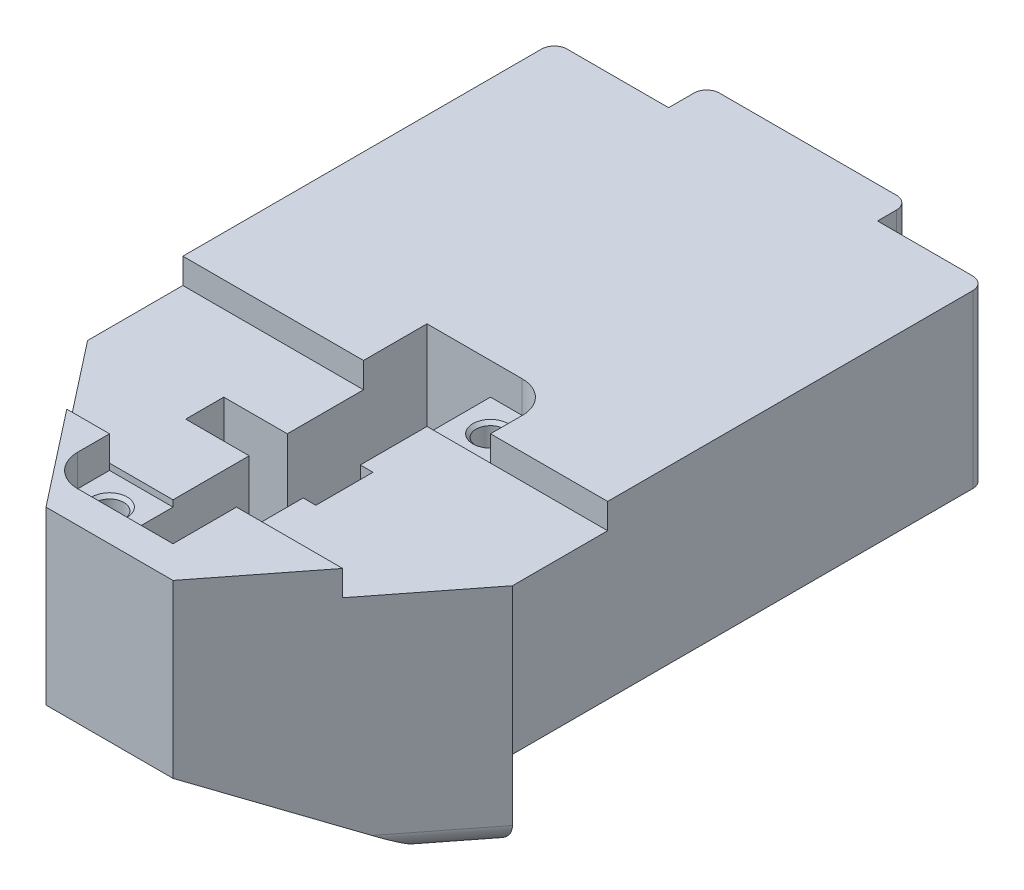
from build123d import *

# Parameters (mm, degrees)
BOSS_EXTRUDE1_DEPTH     = 7.7
SKETCH2_W               = 7
SKETCH2_H               = 3.1
CUT_EXTRUDE1_DEPTH      = 79.027559234
FILLET1_R               = 10
BOSS_EXTRUDE2_DEPTH     = 2
SKETCH4_W               = 109.5
SKETCH4_H               = 25
BOSS_EXTRUDE3_DEPTH     = 33.45
BOSS_EXTRUDE4_REACH     = 117.534
CUT_EXTRUDE2_DEPTH      = 114.458814113
CUT_EXTRUDE2_DEPTH_BACK = 114.458814113
CUT_EXTRUDE3_DEPTH      = 10
FILLET3_R               = 1
CUT_EXTRUDE5_REACH      = 117.534
SKETCH9_W               = 30
SKETCH9_H               = 4
FILLET5_R               = 3
CUT_EXTRUDE4_REACH      = 119.132
SKETCH8_W               = 17
SKETCH8_H               = 5
SKETCH8_W_2             = 19
SKETCH8_H_2             = 7
FILLET6_R               = 2
FILLET7_R               = 2
SKETCH11_W              = 10
SKETCH11_H              = 10
CUT_EXTRUDE6_DEPTH      = 22
CUT_EXTRUDE9_DEPTH      = 5
SKETCH12_R              = 2.275
CUT_EXTRUDE7_DEPTH      = 8
CHAMFER1_SIZE           = 0.5
SKETCH13_W              = 2
SKETCH13_H              = 9
SKETCH13_W_2            = 10
SKETCH13_H_2            = 6
CUT_EXTRUDE10_DEPTH     = 18


with BuildPart() as part:
    # Sketch1 → Boss-Extrude1 (new body)
    with BuildSketch(Plane(origin=(0, 0, 0), x_dir=(1, 0, 0), z_dir=(0, 1, 0))):
        Polygon((0, 0), (-16.35, 0), (-16.35, -9.85), (-2.6, -9.85), (-2.6, -33), (-20.1, -33), (-20.1, -75), (0, -75), align=None)
    extrude(amount=BOSS_EXTRUDE1_DEPTH)

    # Sketch2 → Cut-Extrude1 (cut, through all)
    with BuildSketch(Plane.XY.offset(75)):
        with Locations((-16.6, 3.55)):
            Rectangle(SKETCH2_W, SKETCH2_H)
    extrude(amount=-CUT_EXTRUDE1_DEPTH, mode=Mode.SUBTRACT)

    # Fillet1
    fillet1_edges = [part.edges().sort_by_distance(p)[0] for p in [
        (-2.6, 3.85, 33),
    ]]
    fillet(fillet1_edges, radius=FILLET1_R)

    # Sketch3 → Boss-Extrude2 (add)
    with BuildSketch(Plane(origin=(0, 7.7, 0), x_dir=(1, 0, 0), z_dir=(0, 1, 0))):
        Polygon((0, 4.5), (-33.45, 4.5), (-33.45, -75), (-10, -105), (0, -105), align=None)
    extrude(amount=BOSS_EXTRUDE2_DEPTH)

    # Sketch4 → Boss-Extrude3 (add)
    with BuildSketch(Plane(origin=(0, 0, 0), x_dir=(0, 0, -1), z_dir=(1, 0, 0))):
        with Locations((-50.25, 22.2)):
            Rectangle(SKETCH4_W, SKETCH4_H)
    extrude(amount=-BOSS_EXTRUDE3_DEPTH)

    # Boss-Extrude4: up to this face of the body (flat: up to its plane)
    boss_extrude4_end = Plane(part.part.faces().sort_by_distance((0, 18.36479202, 48.166489813))[0])
    # Sketch5 → Boss-Extrude4 (add, up to the picked face)
    with BuildSketch(Plane.ZY.offset(33.45), mode=Mode.PRIVATE) as boss_extrude4_sk1:
        Polygon((75, 7.7), (75, -5), (82, -5), (105, 7.7), align=None)
    boss_extrude4_tool1 = split(extrude(boss_extrude4_sk1.sketch, amount=-BOSS_EXTRUDE4_REACH, mode=Mode.PRIVATE), bisect_by=boss_extrude4_end, keep=Keep.BOTH, mode=Mode.PRIVATE)
    add(boss_extrude4_tool1.solids().sort_by(Axis((-33.45, 2.665766, 85.441441), (1, 0, 0)))[0])

    # Sketch6 → Cut-Extrude2 (cut, two sides: drawn at the far end of the back side and taken through both)
    with BuildSketch(Plane(origin=(0, 7.7, 0), x_dir=(1, 0, 0), z_dir=(0, 1, 0)).offset(-CUT_EXTRUDE2_DEPTH_BACK)):
        Polygon((-33.45, -75), (-10, -105), (-33.45, -105), align=None)
    extrude(amount=CUT_EXTRUDE2_DEPTH + CUT_EXTRUDE2_DEPTH_BACK, mode=Mode.SUBTRACT)

    # Sketch7 → Cut-Extrude3 (cut)
    with BuildSketch(Plane(origin=(0, 0, 0), x_dir=(0, 0, -1), z_dir=(1, 0, 0))):
        Polygon((-75, 0), (-85, 0), (-80, -5), (-75, -5), align=None)
    extrude(amount=-CUT_EXTRUDE3_DEPTH, mode=Mode.SUBTRACT)

    # Fillet3
    # the kernel refuses this fillet: 1 mm, written as the material it takes off along each edge
    with BuildSketch(Plane(origin=(5.810983209, -5, 80), x_dir=(0, 0.707106781186549, 0.7071067811865459), z_dir=(-1, 0, 0))) as fillet3_piece_1:
        with BuildLine():
            CenterArc((2.324393283, -1), FILLET3_R, 90, 114.469800521)
            Line((1.414213562, -1.414213562), (1.396009968, -1.422497834))
            ThreePointArc((1.396009968, -1.422497834), (0.692964646, -0.721248917), (-0.014142136, -0.014142136))
            Line((-0.014142136, -0.014142136), (0, 0.02))
            Line((0, 0.02), (2.324393283, 0.02))
            Line((2.324393283, 0.02), (2.324393283, 0))
        make_face()
    extrude(amount=15.810983209, mode=Mode.SUBTRACT)
    with BuildSketch(Plane(origin=(-10, -5, 82.5), x_dir=(0, 1, 0), z_dir=(0, 0, -1))) as fillet3_piece_2_section:
        with BuildLine():
            CenterArc((FILLET3_R, -FILLET3_R), FILLET3_R, 90, 90)
            Line((0, -FILLET3_R), (-FILLET3_R * 0.02, -FILLET3_R))
            Line((-FILLET3_R * 0.02, -FILLET3_R), (-FILLET3_R * 0.02, FILLET3_R * 0.02))
            Line((-FILLET3_R * 0.02, FILLET3_R * 0.02), (FILLET3_R, FILLET3_R * 0.02))
            Line((FILLET3_R, FILLET3_R * 0.02), (FILLET3_R, 0))
        make_face()
    fillet3_piece_2 = extrude(amount=10, mode=Mode.PRIVATE)
    fillet3_piece_2 = split(fillet3_piece_2, bisect_by=Plane(origin=(-10.222841489, -6.700692184, 78.299307816), z_dir=(0, 0.7071067811865466, -0.7071067811865485)), keep=Keep.TOP, mode=Mode.PRIVATE)
    add(fillet3_piece_2, mode=Mode.SUBTRACT)
    with BuildSketch(Plane(origin=(5.810983209, -5, 80), x_dir=(0, 0.707106781186549, 0.7071067811865459), z_dir=(-1, 0, 0))) as fillet3_piece_3a_section:
        with BuildLine():
            CenterArc((2.324393283, -1), FILLET3_R, 90, 114.469800521)
            Line((1.414213562, -1.414213562), (1.396009968, -1.422497834))
            ThreePointArc((1.396009968, -1.422497834), (0.692964646, -0.721248917), (-0.014142136, -0.014142136))
            Line((-0.014142136, -0.014142136), (0, 0.02))
            Line((0, 0.02), (2.324393283, 0.02))
            Line((2.324393283, 0.02), (2.324393283, 0))
        make_face()
    fillet3_piece_3a = extrude(amount=21.621966417, mode=Mode.PRIVATE)
    fillet3_piece_3a = split(fillet3_piece_3a, bisect_by=Plane(origin=(-10, -4.567151235, 80.996776665), z_dir=(-1, 0, 0)), keep=Keep.TOP, mode=Mode.PRIVATE)
    with BuildSketch(Plane(origin=(-10, -5, 82.5), x_dir=(0, 1, 0), z_dir=(0, 0, -1))) as fillet3_piece_3b_section:
        with BuildLine():
            CenterArc((FILLET3_R, -FILLET3_R), FILLET3_R, 90, 90)
            Line((0, -FILLET3_R), (-FILLET3_R * 0.02, -FILLET3_R))
            Line((-FILLET3_R * 0.02, -FILLET3_R), (-FILLET3_R * 0.02, FILLET3_R * 0.02))
            Line((-FILLET3_R * 0.02, FILLET3_R * 0.02), (FILLET3_R, FILLET3_R * 0.02))
            Line((FILLET3_R, FILLET3_R * 0.02), (FILLET3_R, 0))
        make_face()
    fillet3_piece_3b = extrude(amount=10, mode=Mode.PRIVATE)
    fillet3_piece_3b = split(fillet3_piece_3b, bisect_by=Plane(origin=(-10.238471404, -4.220535034, 80.779464966), z_dir=(0, -0.7071067811865466, 0.7071067811865485)), keep=Keep.TOP, mode=Mode.PRIVATE)
    fillet3_piece_3 = fillet3_piece_3a & fillet3_piece_3b
    add(fillet3_piece_3, mode=Mode.SUBTRACT)

    # Sketch9 → Cut-Extrude5 (cut, up to next)
    with BuildSketch(Plane(origin=(0, 0, 0), x_dir=(0, 0, -1), z_dir=(1, 0, 0)), mode=Mode.PRIVATE) as cut_extrude5_sk1:
        with Locations((-75, 32.7)):
            Rectangle(SKETCH9_W, SKETCH9_H)
    cut_extrude5_tool1 = extrude(cut_extrude5_sk1.sketch, amount=-CUT_EXTRUDE5_REACH, mode=Mode.PRIVATE) & part.part
    add(cut_extrude5_tool1.solids().sort_by_distance((0, 32.7, 75))[0], mode=Mode.SUBTRACT)

    # Mirror1: part across plane


with BuildPart() as part_1:
    add(part.part)
    add(part.part.mirror(Plane(origin=(0, 7.7, 75), x_dir=(0, 0, 1), z_dir=(-1, 0, 0))))

    # Fillet5
    # the kernel refuses this fillet: 3 mm, written as the material it takes off along each edge
    with BuildSketch(Plane(origin=(-38.068859068, -5, 69.091011854), x_dir=(0, 1, 0), z_dir=(0.6158478756904763, 0, 0.7878650861711843)), Plane(origin=(38.068859068, -5, 69.091011854), x_dir=(-0.7878650861711843, 0, -0.6158478756904764), z_dir=(-0.6158478756904763, 0, 0.7878650861711843))) as fillet5_piece_1:
        with BuildLine():
            CenterArc((FILLET5_R, -FILLET5_R), FILLET5_R, 90, 90)
            Line((0, -FILLET5_R), (0, 0))
            Line((0, 0), (FILLET5_R, 0))
        make_face()
    extrude(amount=23.884769896, mode=Mode.SUBTRACT)

    # Cut-Extrude4: up to this face of the body (flat: up to its plane)
    cut_extrude4_end = Plane(part_1.part.faces().sort_by_distance((0, 0, 47.459676899))[0])
    # Sketch8 → Cut-Extrude4 (cut, up to the picked face)
    with BuildSketch(Plane(origin=(0, 34.7, 0), x_dir=(1, 0, 0), z_dir=(0, 1, 0)), mode=Mode.PRIVATE) as cut_extrude4_sk1:
        with Locations((24.95, 2)):
            Rectangle(SKETCH8_W, SKETCH8_H)
    cut_extrude4_tool1 = split(extrude(cut_extrude4_sk1.sketch, amount=-CUT_EXTRUDE4_REACH, mode=Mode.PRIVATE), bisect_by=cut_extrude4_end, keep=Keep.BOTH, mode=Mode.PRIVATE)
    # Sketch8 → Cut-Extrude4 (cut, up to the picked face)
    with BuildSketch(Plane(origin=(0, 34.7, 0), x_dir=(1, 0, 0), z_dir=(0, 1, 0)), mode=Mode.PRIVATE) as cut_extrude4_sk2:
        with Locations((-24.95, 2)):
            Rectangle(SKETCH8_W_2, SKETCH8_H_2)
    cut_extrude4_tool2 = split(extrude(cut_extrude4_sk2.sketch, amount=-CUT_EXTRUDE4_REACH, mode=Mode.PRIVATE), bisect_by=cut_extrude4_end, keep=Keep.BOTH, mode=Mode.PRIVATE)
    add(cut_extrude4_tool1.solids().sort_by(Axis((24.95, 34.7, -2), (0, -1, 0)))[0], mode=Mode.SUBTRACT)
    add(cut_extrude4_tool2.solids().sort_by(Axis((-24.95, 34.7, -2), (0, -1, 0)))[0], mode=Mode.SUBTRACT)

    # Fillet6
    fillet6_edges = [part_1.edges().sort_by_distance(p)[0] for p in [
        (-15.45, 21.2, -4.5),
        (-33.45, 21.2, 1.5),
    ]]
    fillet(fillet6_edges, radius=FILLET6_R)

    # Fillet7
    fillet7_edges = [part_1.edges().sort_by_distance(p)[0] for p in [
        (33.45, 21.2, 0.5),
        (16.45, 21.2, -4.5),
    ]]
    fillet(fillet7_edges, radius=FILLET7_R)

    # Sketch11 → Cut-Extrude6 (cut)
    with BuildSketch(Plane(origin=(0, 34.7, 0), x_dir=(1, 0, 0), z_dir=(0, 1, 0))):
        Polygon((-5, -90), (-5, -100), (5, -100), (5, -60), (-5, -60), align=None)
        with Locations((0, -55)):
            Rectangle(SKETCH11_W, SKETCH11_H)
    extrude(amount=-CUT_EXTRUDE6_DEPTH, mode=Mode.SUBTRACT)

    # Sketch11<3> → Cut-Extrude9 (cut)
    with BuildSketch(Plane(origin=(0, 34.7, 0), x_dir=(1, 0, 0), z_dir=(0, 1, 0))):
        Polygon((-5, -90), (-5, -100), (5, -100), (5, -60), (5, -50), (-5, -50), align=None)
        with BuildLine():
            Line((-10, -100), (-5, -100))
            Line((-5, -100), (-5, -90))
            Line((-5, -90), (-15, -90))
            Line((-15, -90), (-15, -95))
            ThreePointArc((-15, -95), (-13.535533906, -98.535533906), (-10, -100))
        make_face()
        with BuildLine():
            Line((5, -50), (5, -60))
            Line((5, -60), (15, -60))
            Line((15, -60), (15, -55))
            ThreePointArc((15, -55), (13.535533906, -51.464466094), (10, -50))
            Line((10, -50), (5, -50))
        make_face()
    extrude(amount=-CUT_EXTRUDE9_DEPTH, mode=Mode.SUBTRACT)

    # Sketch12 → Cut-Extrude7 (cut)
    with BuildSketch(Plane(origin=(0, 29.7, 0), x_dir=(1, 0, 0), z_dir=(0, 1, 0))):
        with Locations(Location((10, -55, 0), (0, 0, 270))):
            Circle(SKETCH12_R)
        with Locations(Location((-10, -95, 0), (0, 0, 90))):
            Circle(SKETCH12_R)
    extrude(amount=-CUT_EXTRUDE7_DEPTH, mode=Mode.SUBTRACT)

    # Chamfer1
    chamfer1_edges = [part_1.edges().sort_by_distance(p)[0] for p in [
        (10, 29.7, 52.725),
        (-10, 29.7, 97.275),
    ]]
    chamfer(chamfer1_edges, length=CHAMFER1_SIZE)

    # Sketch13 → Cut-Extrude10 (cut)
    with BuildSketch(Plane(origin=(0, 30.7, 0), x_dir=(1, 0, 0), z_dir=(0, 1, 0))):
        with Locations((6, -75)):
            Rectangle(SKETCH13_W, SKETCH13_H)
        with Locations((-10, -75)):
            Rectangle(SKETCH13_W_2, SKETCH13_H_2)
    extrude(amount=-CUT_EXTRUDE10_DEPTH, mode=Mode.SUBTRACT)


solid = part_1.part
